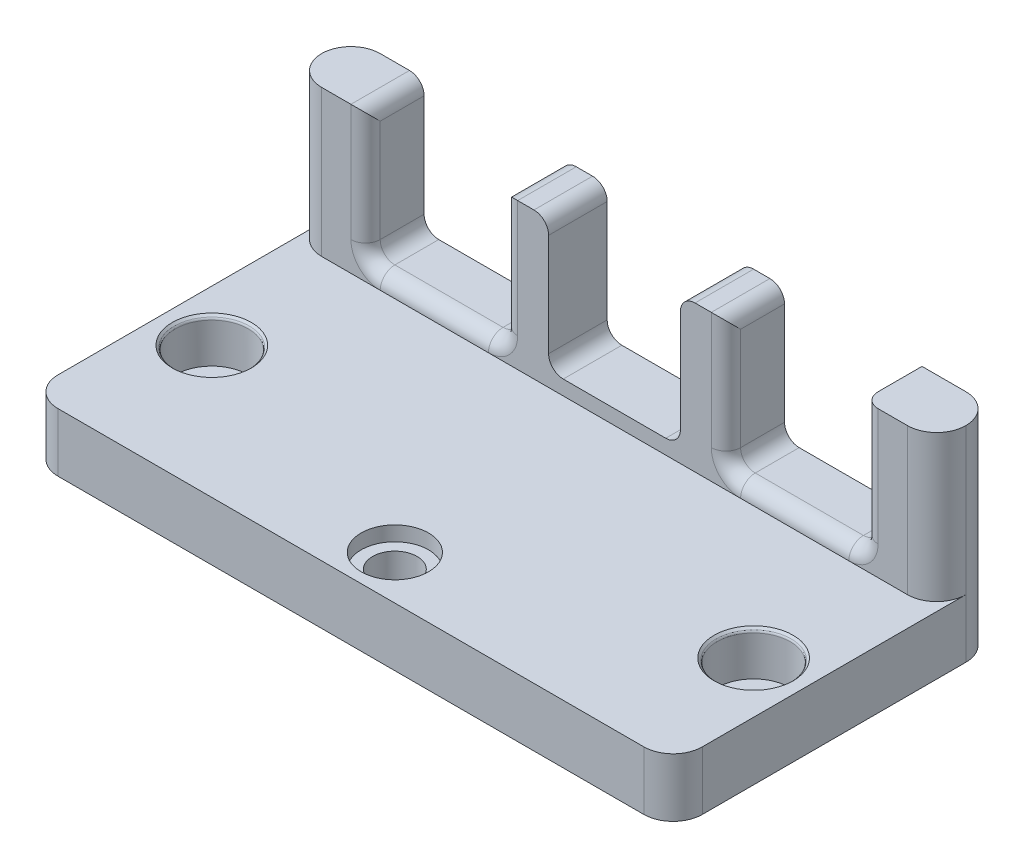
from build123d import *

# Parameters (mm, degrees)
SKETCH1_W           = 220
SKETCH1_H           = 110
BOSS_EXTRUDE1_DEPTH = 20
SKETCH2_R           = 12.49
SKETCH2_R_2         = 7.6
CUT_EXTRUDE1_DEPTH  = 15
SKETCH3_W           = 220
SKETCH3_H           = 20
BOSS_EXTRUDE2_DEPTH = 50
CHAMFER1_SIZE       = 1
FILLET1_R           = 1
FILLET2_R           = 10
SKETCH4_R           = 11.5
CUT_EXTRUDE2_DEPTH  = 5
SKETCH5_W           = 46.94076836
SKETCH5_H           = 60
SKETCH5_W_2         = 45
SKETCH5_H_2         = 90
CUT_EXTRUDE3_DEPTH  = 256.734237051
FILLET4_R           = 5
SKETCH6_R           = 3.2
CUT_EXTRUDE4_DEPTH  = 10


with BuildPart() as part:
    # Sketch1 → Boss-Extrude1 (new body)
    with BuildSketch(Plane(origin=(0, 0, 0), x_dir=(1, 0, 0), z_dir=(0, 1, 0))):
        with Locations((110, 55)):
            Rectangle(SKETCH1_W, SKETCH1_H)
    extrude(amount=BOSS_EXTRUDE1_DEPTH)

    # Sketch2 → Cut-Extrude1 (cut)
    with BuildSketch(Plane(origin=(0, 20, 0), x_dir=(1, 0, 0), z_dir=(0, 1, 0))):
        with Locations(Location((17.5, 45, 0), (0, 0, 270))):
            Circle(SKETCH2_R)
        with Locations(Location((202.5, 45, 0), (0, 0, 90))):
            Circle(SKETCH2_R)
        with Locations(Location((110, 15, 0), (0, 0, 270))):
            Circle(SKETCH2_R_2)
    extrude(amount=-CUT_EXTRUDE1_DEPTH, mode=Mode.SUBTRACT)

    # Sketch3 → Boss-Extrude2 (add)
    with BuildSketch(Plane(origin=(0, 20, 0), x_dir=(1, 0, 0), z_dir=(0, 1, 0))):
        with Locations((110, 100)):
            Rectangle(SKETCH3_W, SKETCH3_H)
    extrude(amount=BOSS_EXTRUDE2_DEPTH)

    # Chamfer1
    chamfer1_edges = [part.edges().sort_by_distance(p)[0] for p in [
        (17.5, 20, -57.49),
        (202.5, 20, -32.51),
    ]]
    chamfer(chamfer1_edges, length=CHAMFER1_SIZE)

    # Fillet1
    fillet1_edges = [part.edges().sort_by_distance(p)[0] for p in [
        (202.5, 19, -32.51),
        (17.5, 19, -57.49),
    ]]
    fillet(fillet1_edges, radius=FILLET1_R)

    # Fillet2
    fillet2_edges = [part.edges().sort_by_distance(p)[0] for p in [
        (220, 45, -90),
        (0, 45, -90),
        (0, 35, -110),
        (0, 10, 0),
        (220, 35, -110),
        (220, 10, 0),
    ]]
    fillet(fillet2_edges, radius=FILLET2_R - 0.0001)  # a hair under: the kernel refuses the full size

    # Sketch4 → Cut-Extrude2 (cut)
    with BuildSketch(Plane(origin=(0, 20, 0), x_dir=(1, 0, 0), z_dir=(0, 1, 0))):
        with Locations(Location((110, 15, 0), (0, 0, 270))):
            Circle(SKETCH4_R)
    extrude(amount=-CUT_EXTRUDE2_DEPTH, mode=Mode.SUBTRACT)

    # Sketch5 → Cut-Extrude3 (cut, through all)
    with BuildSketch(Plane(origin=(0, 0, -110), x_dir=(-1, 0, 0), z_dir=(0, 0, -1))):
        with Locations((-171.52961582, 55)):
            Rectangle(SKETCH5_W, SKETCH5_H)
        with Locations((-48.47038418, 55)):
            Rectangle(SKETCH5_W, SKETCH5_H)
        with Locations((-110, 70)):
            Rectangle(SKETCH5_W_2, SKETCH5_H_2)
    extrude(amount=-CUT_EXTRUDE3_DEPTH, mode=Mode.SUBTRACT)

    # Fillet4
    fillet4_edges = [part.edges().sort_by_distance(p)[0] for p in [
        (195, 47.5, -90),
        (148.05923164, 47.5, -90),
        (25, 47.5, -90),
        (71.94076836, 47.5, -90),
        (171.52961582, 25, -90),
        (48.47038418, 25, -90),
        (25, 70, -100),
        (25, 25, -100),
        (71.94076836, 25, -100),
        (71.94076836, 70, -100),
        (87.5, 70, -100),
        (87.5, 25, -100),
        (132.5, 25, -100),
        (132.5, 70, -100),
        (148.05923164, 70, -100),
        (148.05923164, 25, -100),
        (195, 25, -100),
    ]]
    fillet(fillet4_edges, radius=FILLET4_R - 0.0001)  # a hair under: the kernel refuses the full size

    # Sketch6 → Cut-Extrude4 (cut)
    with BuildSketch(Plane(origin=(0, 0, -110), x_dir=(-1, 0, 0), z_dir=(0, 0, -1))):
        with Locations((-110, 12.5)):
            Circle(SKETCH6_R)
    extrude(amount=-CUT_EXTRUDE4_DEPTH, mode=Mode.SUBTRACT)


solid = part.part
